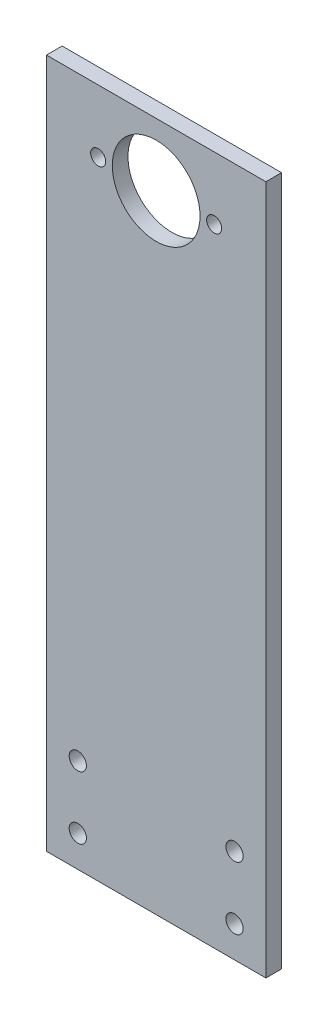
from build123d import *

# Parameters (mm, degrees)
SKETCH1_R           = 2.75
SKETCH1_R_2         = 2.4
SKETCH1_R_3         = 14
BOSS_EXTRUDE1_DEPTH = 5


with BuildPart() as part:
    # Sketch1 → Boss-Extrude1 (new body)
    with BuildSketch(Plane.XY):
        Polygon((-35, 100), (-35, -100), (-35, -120.000000001), (35, -120.000000001), (35, -100), (35, 100), align=None)
        with Locations((-25, -110)):
            Circle(SKETCH1_R, mode=Mode.SUBTRACT)
        with Locations((-25, -90)):
            Circle(SKETCH1_R, mode=Mode.SUBTRACT)
        with Locations((25, -110)):
            Circle(SKETCH1_R, mode=Mode.SUBTRACT)
        with Locations((25, -90)):
            Circle(SKETCH1_R, mode=Mode.SUBTRACT)
        with Locations((-18.5, 80)):
            Circle(SKETCH1_R_2, mode=Mode.SUBTRACT)
        with Locations((0, 80)):
            Circle(SKETCH1_R_3, mode=Mode.SUBTRACT)
        with Locations((18.5, 80)):
            Circle(SKETCH1_R_2, mode=Mode.SUBTRACT)
    extrude(amount=BOSS_EXTRUDE1_DEPTH)


solid = part.part
